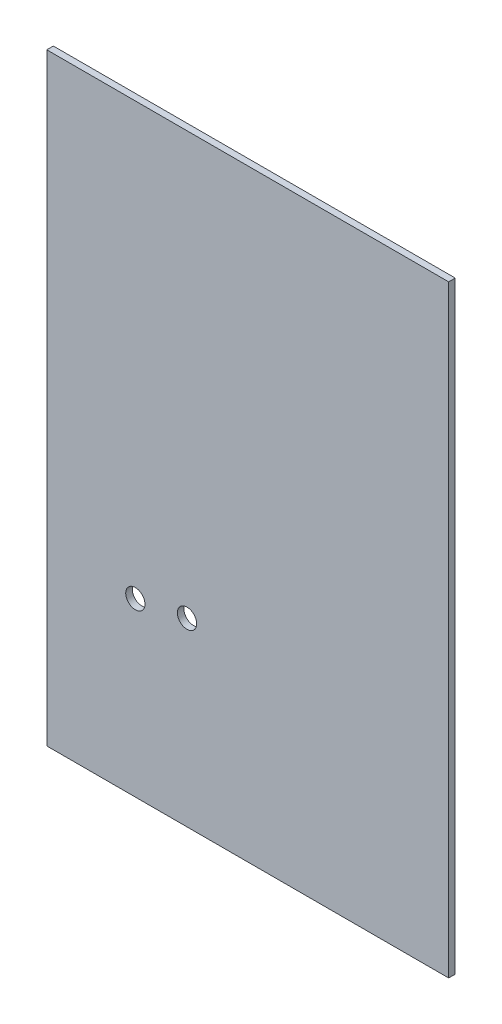
from build123d import *

# Parameters (mm, degrees)
SKETCH1_W           = 292.1
SKETCH1_H           = 438.15
SKETCH1_R           = 7
BOSS_EXTRUDE1_DEPTH = 4.7625


with BuildPart() as part:
    # Sketch1 → Boss-Extrude1 (new body)
    with BuildSketch(Plane.XY):
        with Locations((146.05, -219.075)):
            Rectangle(SKETCH1_W, SKETCH1_H)
        with Locations((64.374426387, -313.256382727)):
            Circle(SKETCH1_R, mode=Mode.SUBTRACT)
        with Locations((101.925695163, -306.813385495)):
            Circle(SKETCH1_R, mode=Mode.SUBTRACT)
    extrude(amount=BOSS_EXTRUDE1_DEPTH)


solid = part.part
